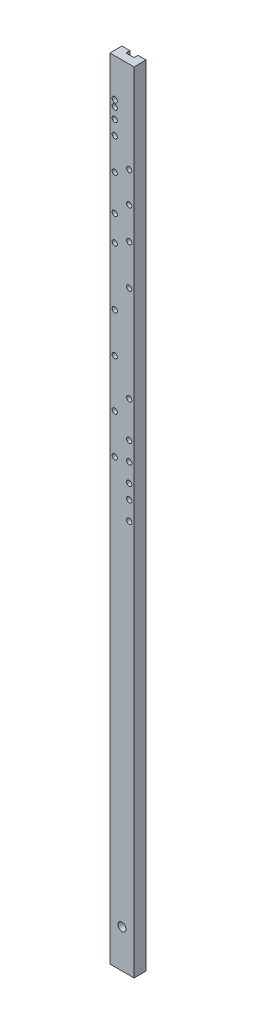
from build123d import *

# Parameters (mm, degrees)
SKETCH1_W           = 19.05
SKETCH1_H           = 1244.6
BOSS_EXTRUDE1_DEPTH = 19.05
SKETCH2_R           = 6.35
CUT_EXTRUDE1_DEPTH  = 623.882890277
SKETCH4_W           = 12.7
SKETCH4_H           = 12.7
CUT_EXTRUDE2_DEPTH  = 1245.78222518
SKETCH5_R           = 1.905
CUT_EXTRUDE3_DEPTH  = 623.882890277
SKETCH6_R           = 4.1275
CUT_EXTRUDE4_DEPTH  = 7.747


with BuildPart() as part:
    # Sketch1 → Boss-Extrude1 (new, symmetric)
    with BuildSketch(Plane(origin=(0, 0, 0), x_dir=(0, 0, -1), z_dir=(1, 0, 0))):
        Rectangle(SKETCH1_W, SKETCH1_H)
    extrude(amount=BOSS_EXTRUDE1_DEPTH, both=True)

    # Sketch2 → Cut-Extrude1 (cut, through all)
    with BuildSketch(Plane.XY.offset(9.525)):
        with Locations((0, -561.975)):
            Circle(SKETCH2_R)
    extrude(amount=-CUT_EXTRUDE1_DEPTH, mode=Mode.SUBTRACT)

    # Sketch4 → Cut-Extrude2 (cut, through all)
    with BuildSketch(Plane(origin=(0, 622.3, 0), x_dir=(1, 0, 0), z_dir=(0, 1, 0))):
        with Locations((0, 9.525)):
            Rectangle(SKETCH4_W, SKETCH4_H)
    extrude(amount=-CUT_EXTRUDE2_DEPTH, mode=Mode.SUBTRACT)

    # Sketch5 → Cut-Extrude3 (cut, through all)
    with BuildSketch(Plane.XY.offset(9.525)):
        with Locations((-11.43, 513.302135886)):
            Circle(SKETCH5_R)
        with Locations((11.43, 478.263647874)):
            Circle(SKETCH5_R)
        with Locations((-11.43, 463.345550332)):
            Circle(SKETCH5_R)
        with Locations((11.43, 430.113859098)):
            Circle(SKETCH5_R)
        with Locations((-11.43, 407.064148942)):
            Circle(SKETCH5_R)
        with Locations((11.43, 379.842698104)):
            Circle(SKETCH5_R)
        with Locations((-11.43, 366.551491472)):
            Circle(SKETCH5_R)
        with Locations((11.43, 316.418969048)):
            Circle(SKETCH5_R)
        with Locations((-11.43, 535.422112699)):
            Circle(SKETCH5_R)
        with Locations((-11.43, 552.28498253)):
            Circle(SKETCH5_R)
        with Locations((-11.43, 562.430692594)):
            Circle(SKETCH5_R)
        with Locations((11.43, 165.149796436)):
            Circle(SKETCH5_R)
        with Locations((11.43, 108.45633512)):
            Circle(SKETCH5_R)
        with Locations((11.43, 79.058526758)):
            Circle(SKETCH5_R)
        with Locations((11.43, 49.653866377)):
            Circle(SKETCH5_R)
        with Locations((11.43, 27.043187605)):
            Circle(SKETCH5_R)
        with Locations((11.43, -2.198894726)):
            Circle(SKETCH5_R)
        with Locations((-11.43, 74.386924519)):
            Circle(SKETCH5_R)
        with Locations((-11.43, 137.013245544)):
            Circle(SKETCH5_R)
        with Locations((-11.43, 212.596714918)):
            Circle(SKETCH5_R)
        with Locations((-11.43, 275.179690854)):
            Circle(SKETCH5_R)
    extrude(amount=-CUT_EXTRUDE3_DEPTH, mode=Mode.SUBTRACT)

    # Sketch6 → Cut-Extrude4 (cut)
    with BuildSketch(Plane.XY.offset(9.525)):
        with Locations((-11.43, 513.302135886)):
            Circle(SKETCH6_R)
        with Locations((11.43, 478.263647874)):
            Circle(SKETCH6_R)
        with Locations((-11.43, 463.345550332)):
            Circle(SKETCH6_R)
        with Locations((11.43, 430.113859098)):
            Circle(SKETCH6_R)
        with Locations((11.43, 379.842698104)):
            Circle(SKETCH6_R)
        with Locations((11.43, 316.418969048)):
            Circle(SKETCH6_R)
        with Locations((-11.43, 366.551491472)):
            Circle(SKETCH6_R)
        with Locations((-11.43, 407.064148942)):
            Circle(SKETCH6_R)
        with Locations((-11.43, 562.430692594)):
            Circle(SKETCH6_R)
        with Locations((-11.43, 552.28498253)):
            Circle(SKETCH6_R)
        with Locations((-11.43, 535.422112699)):
            Circle(SKETCH6_R)
        with Locations((-11.43, 275.179690854)):
            Circle(SKETCH6_R)
        with Locations((-11.43, 212.596714918)):
            Circle(SKETCH6_R)
        with Locations((11.43, 165.149796436)):
            Circle(SKETCH6_R)
        with Locations((-11.43, 137.013245544)):
            Circle(SKETCH6_R)
        with Locations((11.43, 108.45633512)):
            Circle(SKETCH6_R)
        with Locations((11.43, 79.058526758)):
            Circle(SKETCH6_R)
        with Locations((-11.43, 74.386924519)):
            Circle(SKETCH6_R)
        with Locations((11.43, 49.653866377)):
            Circle(SKETCH6_R)
        with Locations((11.43, 27.043187605)):
            Circle(SKETCH6_R)
        with Locations((11.43, -2.198894726)):
            Circle(SKETCH6_R)
    extrude(amount=-CUT_EXTRUDE4_DEPTH, mode=Mode.SUBTRACT)


solid = part.part
